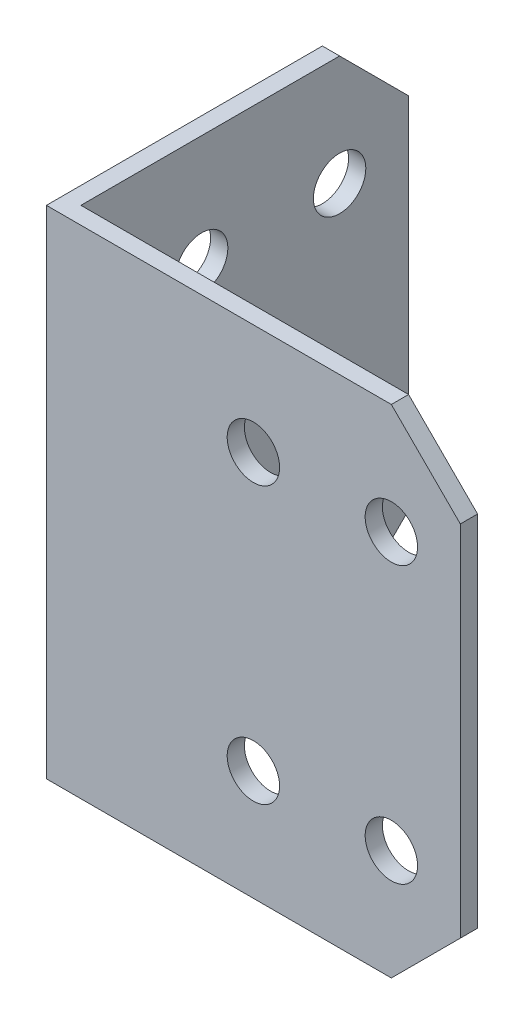
from build123d import *

# Parameters (mm, degrees)
BOSS_EXTRUDE1_DEPTH = 45.72
SKETCH2_R           = 2.413
CUT_EXTRUDE1_DEPTH  = 59.307156693
SKETCH3_R           = 2.413
CUT_EXTRUDE2_DEPTH  = 64.762509842
CHAMFER1_SIZE       = 6.35


with BuildPart() as part:
    # Sketch1 → Boss-Extrude1 (new body)
    with BuildSketch(Plane(origin=(0, 0, 0), x_dir=(1, 0, 0), z_dir=(0, 1, 0))):
        Polygon((-18.109259259, 25.341203704), (-16.521759259, 25.341203704), (-16.521759259, -4.821296296), (19.990740741, -4.821296296), (19.990740741, -6.408796296), (-18.109259259, -6.408796296), align=None)
    extrude(amount=BOSS_EXTRUDE1_DEPTH)

    # Sketch2 → Cut-Extrude1 (cut, through all)
    with BuildSketch(Plane(origin=(0, 0, 4.821296296), x_dir=(-1, 0, 0), z_dir=(0, 0, -1))):
        with Locations((-0.940740741, 35.56)):
            Circle(SKETCH2_R)
        with Locations((-13.640740741, 35.56)):
            Circle(SKETCH2_R)
        with Locations((-13.640740741, 10.16)):
            Circle(SKETCH2_R)
        with Locations((-0.940740741, 10.16)):
            Circle(SKETCH2_R)
    extrude(amount=-CUT_EXTRUDE1_DEPTH, mode=Mode.SUBTRACT)

    # Sketch3 → Cut-Extrude2 (cut, through all)
    with BuildSketch(Plane(origin=(-16.521759259, 0, 0), x_dir=(0, 0, -1), z_dir=(1, 0, 0))):
        with Locations((6.291203704, 35.56)):
            Circle(SKETCH3_R)
        with Locations((18.991203704, 35.56)):
            Circle(SKETCH3_R)
        with Locations((18.991203704, 10.16)):
            Circle(SKETCH3_R)
        with Locations((6.291203704, 10.16)):
            Circle(SKETCH3_R)
    extrude(amount=-CUT_EXTRUDE2_DEPTH, mode=Mode.SUBTRACT)

    # Chamfer1
    chamfer1_edges = [part.edges().sort_by_distance(p)[0] for p in [
        (19.990740741, 45.72, 5.615046296),
        (19.990740741, 0, 5.615046296),
        (-17.315509259, 0, -25.341203704),
        (-17.315509259, 45.72, -25.341203704),
    ]]
    chamfer(chamfer1_edges, length=CHAMFER1_SIZE)


solid = part.part
